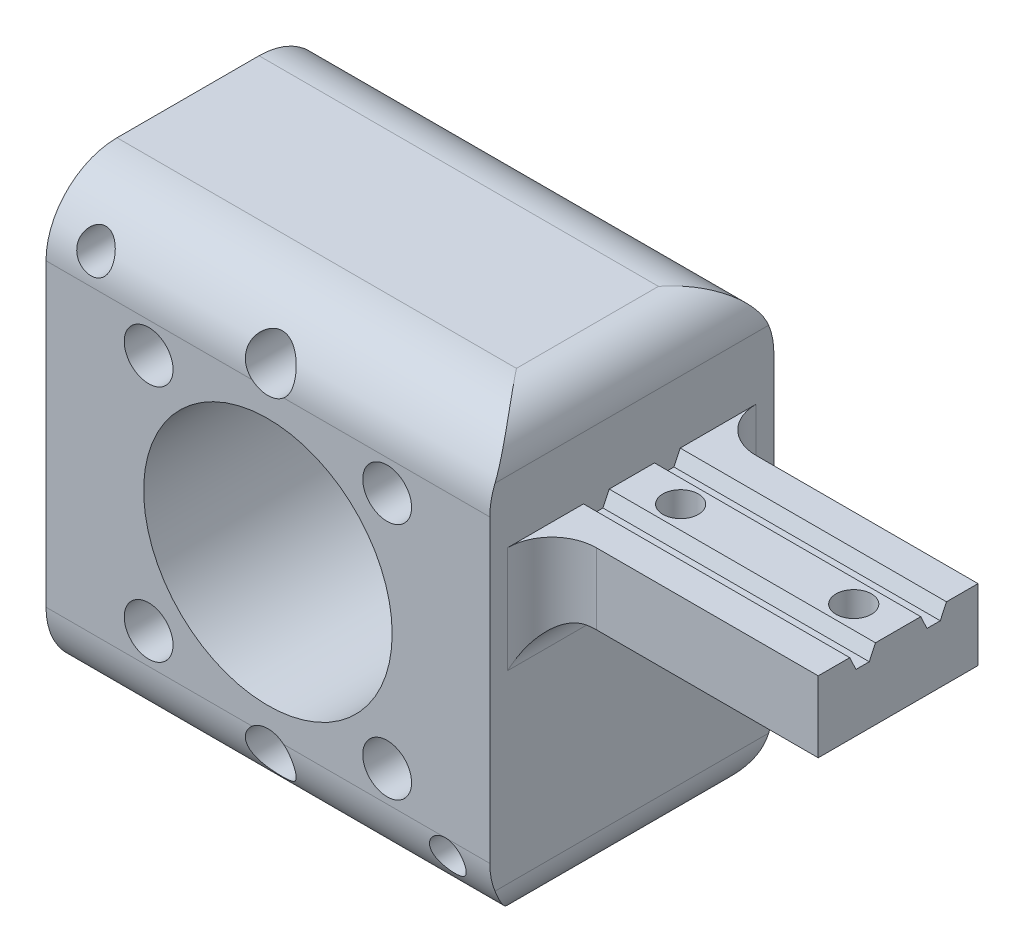
from build123d import *

# Parameters (mm, degrees)
SKETCH1_W           = 50
SKETCH1_H           = 49.8
SKETCH1_R           = 14
BOSS_EXTRUDE1_DEPTH = 32
SKETCH5_R           = 2
CUT_EXTRUDE2_DEPTH  = 48.634126422
SKETCH12_W          = 30
SKETCH12_H          = 8
BOSS_EXTRUDE3_DEPTH = 18
CUT_EXTRUDE3_DEPTH  = 30
FILLET5_R           = 5
FILLET6_R           = 5
FILLET8_R           = 4
SKETCH14_R          = 2
CUT_EXTRUDE4_DEPTH  = 10
SKETCH16_R          = 2.75
CUT_EXTRUDE5_DEPTH  = 69.330154398
FILLET10_R          = 8
FILLET11_R          = 5


with BuildPart() as part:
    # Sketch1 → Boss-Extrude1 (new body)
    with BuildSketch(Plane.XY):
        Rectangle(SKETCH1_W, SKETCH1_H)
        Circle(SKETCH1_R, mode=Mode.SUBTRACT)
    extrude(amount=BOSS_EXTRUDE1_DEPTH)

    # Sketch5 → Cut-Extrude2 (cut, through all)
    with BuildSketch(Plane.XY.offset(32)):
        with Locations((20, -18.9)):
            Circle(SKETCH5_R)
        with Locations((-20, 19.9)):
            Circle(SKETCH5_R)
    extrude(amount=-CUT_EXTRUDE2_DEPTH, mode=Mode.SUBTRACT)

    # Sketch12 → Boss-Extrude3 (add)
    with BuildSketch(Plane(origin=(0, 0, 25), x_dir=(-1, 0, 0), z_dir=(0, 0, -1))):
        with Locations((-40, 8.9)):
            Rectangle(SKETCH12_W, SKETCH12_H)
    extrude(amount=BOSS_EXTRUDE3_DEPTH)

    # Sketch13 → Cut-Extrude3 (cut)
    with BuildSketch(Plane(origin=(55, 0, 0), x_dir=(0, 0, -1), z_dir=(1, 0, 0))):
        Polygon((-18.550538513, 12.9), (-21.449461487, 12.9), (-20.75, 11.4), (-19.25, 11.4), align=None)
        Polygon((-10.550538513, 12.9), (-13.449461487, 12.9), (-12.75, 11.4), (-11.25, 11.4), align=None)
    extrude(amount=-CUT_EXTRUDE3_DEPTH, mode=Mode.SUBTRACT)

    # Fillet5
    fillet5_edges = [part.edges().sort_by_distance(p)[0] for p in [
        (25, 8.9, 25),
    ]]
    fillet(fillet5_edges, radius=FILLET5_R)

    # Fillet6
    fillet6_edges = [part.edges().sort_by_distance(p)[0] for p in [
        (25, 8.9, 7),
    ]]
    fillet(fillet6_edges, radius=FILLET6_R)

    # Fillet8
    fillet8_edges = [part.edges().sort_by_distance(p)[0] for p in [
        (25, 4.9, 16),
    ]]
    fillet(fillet8_edges, radius=FILLET8_R)

    # Sketch14 → Cut-Extrude4 (cut)
    with BuildSketch(Plane(origin=(0, 12.9, 0), x_dir=(1, 0, 0), z_dir=(0, 1, 0))):
        with Locations(Location((50, -16, 0), (0, 0, 180))):
            Circle(SKETCH14_R)
        with Locations(Location((30.5, -16, 0), (0, 0, 180))):
            Circle(SKETCH14_R)
    extrude(amount=-CUT_EXTRUDE4_DEPTH, mode=Mode.SUBTRACT)

    # Sketch16 → Cut-Extrude5 (cut, through all)
    with BuildSketch(Plane.XY.offset(32)):
        with Locations((0, 19)):
            Circle(SKETCH16_R)
        with Locations((13.435028843, 13.435028843)):
            Circle(SKETCH16_R)
        with Locations((13.435028843, -13.435028843)):
            Circle(SKETCH16_R)
        with Locations((0, -19)):
            Circle(SKETCH16_R)
        with Locations((-13.435028843, -13.435028843)):
            Circle(SKETCH16_R)
        with Locations((-13.435028843, 13.435028843)):
            Circle(SKETCH16_R)
    extrude(amount=-CUT_EXTRUDE5_DEPTH, mode=Mode.SUBTRACT)

    # Fillet10
    # the kernel refuses this fillet: 8 mm, written as the material it takes off along each edge
    with BuildSketch(Plane(origin=(45, -24.9, 32), x_dir=(0, 1, 0), z_dir=(-1, 0, 0)), Plane(origin=(45, -24.9, 0), x_dir=(0, 0, 1), z_dir=(-1, 0, 0)), Plane(origin=(-45, 24.9, 0), x_dir=(0, 0, 1), z_dir=(1, 0, 0))) as fillet10_piece_1:
        with BuildLine():
            CenterArc((FILLET10_R, FILLET10_R), FILLET10_R, 180, 90)
            Line((0, FILLET10_R), (0, 0))
            Line((0, 0), (FILLET10_R, 0))
        make_face()
    extrude(amount=90, mode=Mode.SUBTRACT)
    with BuildSketch(Plane(origin=(-45, 24.9, 32), x_dir=(0, 0, -1), z_dir=(1, 0, 0))) as fillet10_piece_2:
        with BuildLine():
            CenterArc((FILLET10_R, -FILLET10_R), FILLET10_R, 90, 90)
            Line((0, -FILLET10_R), (0, 0))
            Line((0, 0), (FILLET10_R, 0))
        make_face()
    extrude(amount=90, mode=Mode.SUBTRACT)

    # Fillet11
    # the kernel refuses this fillet: 5 mm, written as the material it takes off along each edge
    with BuildSketch(Plane(origin=(25, -24.9, -4.5), x_dir=(0, 1, 0), z_dir=(0, 0, 1))) as fillet11_piece_1:
        with BuildLine():
            CenterArc((FILLET11_R, FILLET11_R), FILLET11_R, 180, 90)
            Line((0, FILLET11_R), (0, 0))
            Line((0, 0), (FILLET11_R, 0))
        make_face()
    extrude(amount=41, mode=Mode.SUBTRACT)
    with BuildSketch(Plane(origin=(25, 24.9, -4.5), x_dir=(0, -1, 0), z_dir=(0, 0, 1))) as fillet11_piece_2:
        with BuildLine():
            CenterArc((FILLET11_R, -FILLET11_R), FILLET11_R, 90, 90)
            Line((0, -FILLET11_R), (0, 0))
            Line((0, 0), (FILLET11_R, 0))
        make_face()
    extrude(amount=41, mode=Mode.SUBTRACT)


solid = part.part
